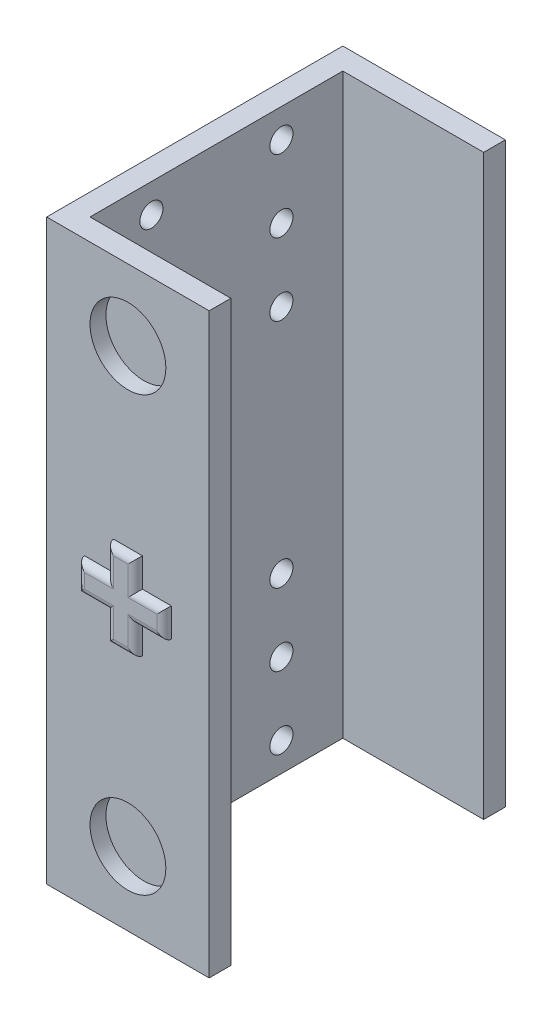
from build123d import *

# Parameters (mm, degrees)
ESQUISSE1_W             = 22.5
ESQUISSE1_H             = 80
BOSS_EXTRU_1_DEPTH      = 3
ESQUISSE2_W             = 3
ESQUISSE2_H             = 80
BOSS_EXTRU_2_DEPTH      = 35
ESQUISSE3_W             = 22.5
ESQUISSE3_H             = 80
BOSS_EXTRU_3_DEPTH      = 3
ESQUISSE4_R             = 5.25
ENL_V_MAT_EXTRU_1_DEPTH = 2.2
ENL_V_START             = -1.8
ENL_V_MAT_EXTRU_2_DEPTH = 1.2
ENL_V_START_2           = -2.2
ESQUISSE6_R             = 5.25
ENL_V_MAT_EXTRU_3_DEPTH = 2.2
BOSS_EXTRU_4_DEPTH      = 1
ESQUISSE8_R             = 1.6
ENL_V_MAT_EXTRU_4_DEPTH = 4
CONG_2_R                = 1


with BuildPart() as part:
    # Esquisse1 → Boss.-Extru.1 (new body)
    with BuildSketch(Plane.XY):
        with Locations((11.25, 40)):
            Rectangle(ESQUISSE1_W, ESQUISSE1_H)
    extrude(amount=BOSS_EXTRU_1_DEPTH)

    # Esquisse2 → Boss.-Extru.2 (add)
    with BuildSketch(Plane.XY.offset(3)):
        with Locations((1.5, 40)):
            Rectangle(ESQUISSE2_W, ESQUISSE2_H)
    extrude(amount=BOSS_EXTRU_2_DEPTH)

    # Esquisse3 → Boss.-Extru.3 (add)
    with BuildSketch(Plane.XY.offset(38)):
        with Locations((11.25, 40)):
            Rectangle(ESQUISSE3_W, ESQUISSE3_H)
    extrude(amount=BOSS_EXTRU_3_DEPTH)

    # Esquisse4 → Enlèv. mat.-Extru.1 (cut)
    with BuildSketch(Plane(origin=(0, 0, 0), x_dir=(-1, 0, 0), z_dir=(0, 0, -1))):
        with Locations((-11.25, 10.15)):
            Circle(ESQUISSE4_R)
        with Locations((-11.25, 70.15)):
            Circle(ESQUISSE4_R)
    extrude(amount=-ENL_V_MAT_EXTRU_1_DEPTH, mode=Mode.SUBTRACT)

    # Esquisse5 → Enlèv. mat.-Extru.2 (cut)
    with BuildSketch(Plane.XY.offset(3).offset(ENL_V_START)):
        Polygon((4.5, 37.75), (9, 37.75), (9, 33.25), (13.5, 33.25), (13.5, 37.75), (18, 37.75), (18, 42.25), (13.5, 42.25), (13.5, 46.75), (9, 46.75), (9, 42.25), (4.5, 42.25), align=None)
    extrude(amount=-ENL_V_MAT_EXTRU_2_DEPTH, mode=Mode.SUBTRACT)

    # Esquisse6 → Enlèv. mat.-Extru.3 (cut)
    with BuildSketch(Plane.XY.offset(41).offset(ENL_V_START_2)):
        with Locations(Location((11.25, 10.15, 0), (0, 0, 180))):
            Circle(ESQUISSE6_R)
        with Locations(Location((11.25, 70.15, 0), (0, 0, 180))):
            Circle(ESQUISSE6_R)
    extrude(amount=ENL_V_MAT_EXTRU_3_DEPTH, mode=Mode.SUBTRACT)

    # Esquisse7 → Boss.-Extru.4 (add)
    with BuildSketch(Plane.XY.offset(41)):
        Polygon((5.25, 42), (9.25, 42), (9.25, 46), (13.25, 46), (13.25, 42), (17.25, 42), (17.25, 38), (13.25, 38), (13.25, 34), (9.25, 34), (9.25, 38), (5.25, 38), align=None)
    extrude(amount=BOSS_EXTRU_4_DEPTH)

    # Esquisse8 → Enlèv. mat.-Extru.4 (cut)
    with BuildSketch(Plane.ZY):
        with Locations((29.5, 76)):
            Circle(ESQUISSE8_R)
        with Locations((29.5, 66)):
            Circle(ESQUISSE8_R)
        with Locations((29.5, 56)):
            Circle(ESQUISSE8_R)
        with Locations((11.5, 76)):
            Circle(ESQUISSE8_R)
        with Locations((11.5, 66)):
            Circle(ESQUISSE8_R)
        with Locations((11.5, 56)):
            Circle(ESQUISSE8_R)
        with Locations((11.5, 4)):
            Circle(ESQUISSE8_R)
        with Locations((11.5, 14)):
            Circle(ESQUISSE8_R)
        with Locations((11.5, 24)):
            Circle(ESQUISSE8_R)
        with Locations((29.5, 24)):
            Circle(ESQUISSE8_R)
        with Locations((29.5, 14)):
            Circle(ESQUISSE8_R)
        with Locations((29.5, 4)):
            Circle(ESQUISSE8_R)
    extrude(amount=-ENL_V_MAT_EXTRU_4_DEPTH, mode=Mode.SUBTRACT)

    # Congé2
    cong_2_edges = [part.edges().sort_by_distance(p)[0] for p in [
        (11.25, 46, 42),
        (9.25, 44, 42),
        (13.25, 44, 42),
        (15.25, 42, 42),
        (17.25, 40, 42),
        (15.25, 38, 42),
        (13.25, 36, 42),
        (9.25, 36, 42),
        (7.25, 38, 42),
        (7.25, 42, 42),
        (5.25, 40, 42),
        (11.25, 34, 42),
    ]]
    fillet(cong_2_edges, radius=CONG_2_R - 0.0001)  # a hair under: the kernel refuses the full size


solid = part.part
